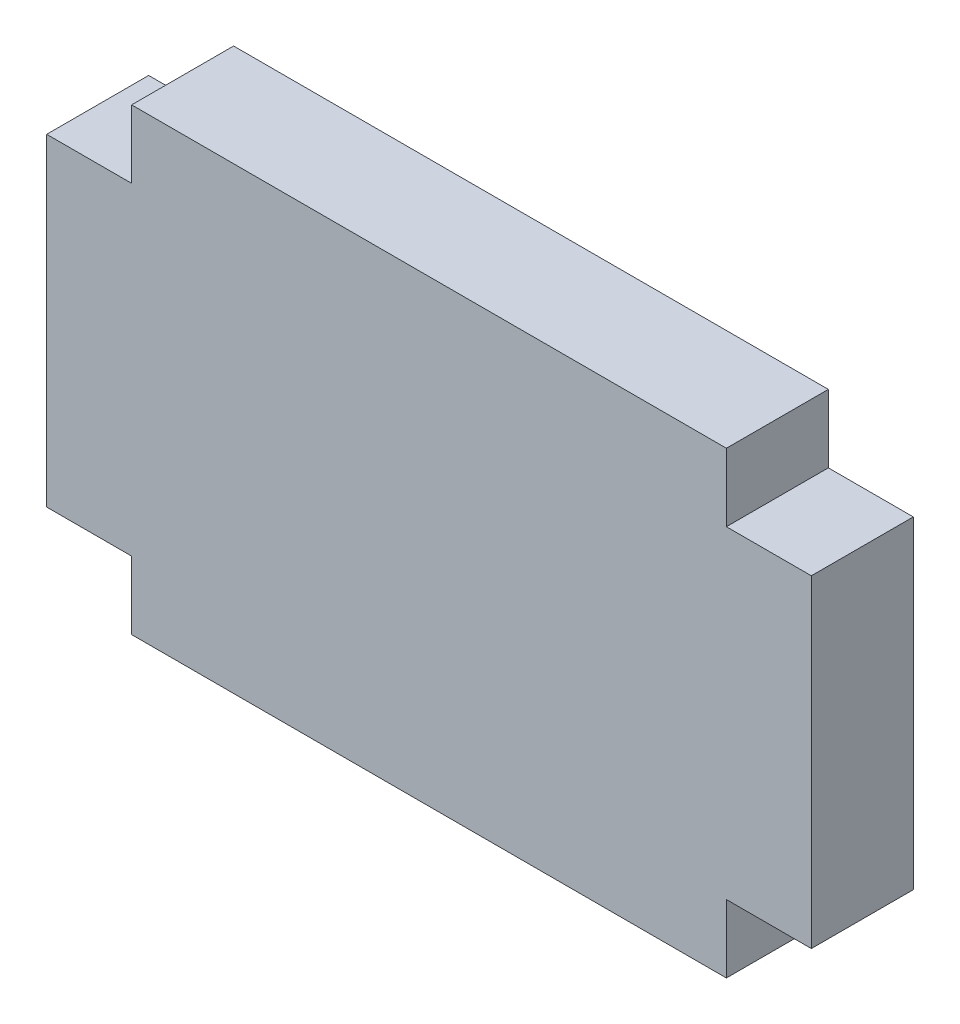
from build123d import *

# Parameters (mm, degrees)
RESSALTO_EXTRUS_O1_DEPTH = 6


with BuildPart() as part:
    # Esboço1 → Ressalto-extrusão1 (new body)
    with BuildSketch(Plane.XY):
        Polygon((-22.5, 9.5), (-22.5, -9.5), (-17.5, -9.5), (-17.5, -13.5), (17.5, -13.5), (17.5, -9.5), (22.5, -9.5), (22.5, 9.5), (17.5, 9.5), (17.5, 13.5), (-17.5, 13.5), (-17.5, 9.5), align=None)
    extrude(amount=RESSALTO_EXTRUS_O1_DEPTH)


solid = part.part
